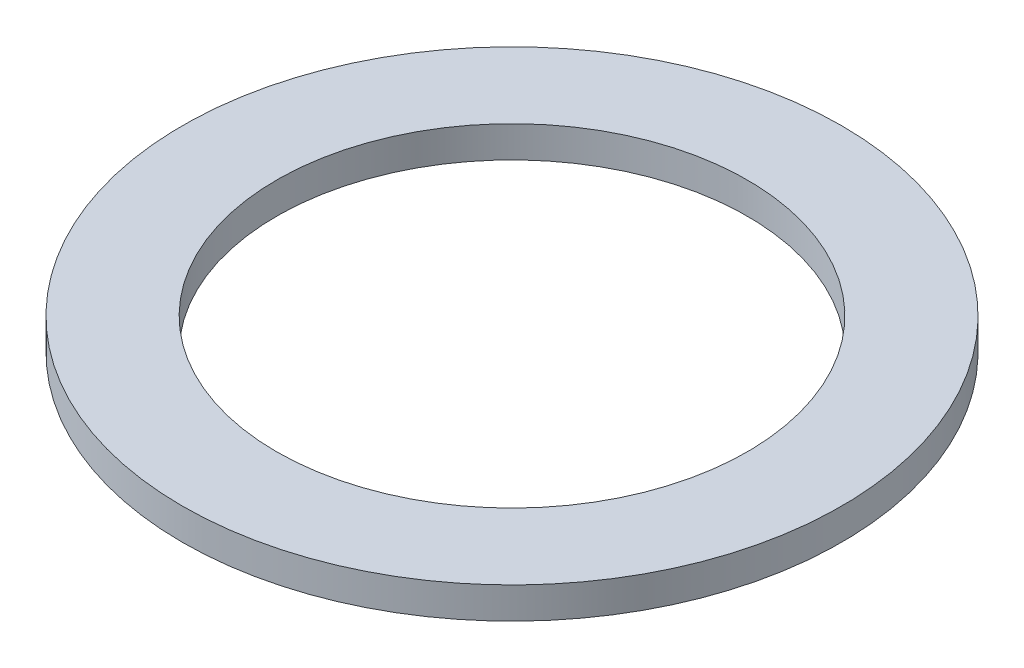
from build123d import *

# Parameters (mm, degrees)
SKETCH1_R           = 52.5
BOSS_EXTRUDE1_DEPTH = 5
SKETCH2_R           = 37.5
CUT_EXTRUDE1_DEPTH  = 75.414380331


with BuildPart() as part:
    # Sketch1 → Boss-Extrude1 (new body)
    with BuildSketch(Plane(origin=(0, 0, 0), x_dir=(1, 0, 0), z_dir=(0, 1, 0))):
        Circle(SKETCH1_R)
    extrude(amount=BOSS_EXTRUDE1_DEPTH)

    # Sketch2 → Cut-Extrude1 (cut, through all)
    with BuildSketch(Plane(origin=(0, 0, 0), x_dir=(1, 0, 0), z_dir=(0, 1, 0))):
        Circle(SKETCH2_R)
    extrude(amount=CUT_EXTRUDE1_DEPTH, mode=Mode.SUBTRACT)


solid = part.part
